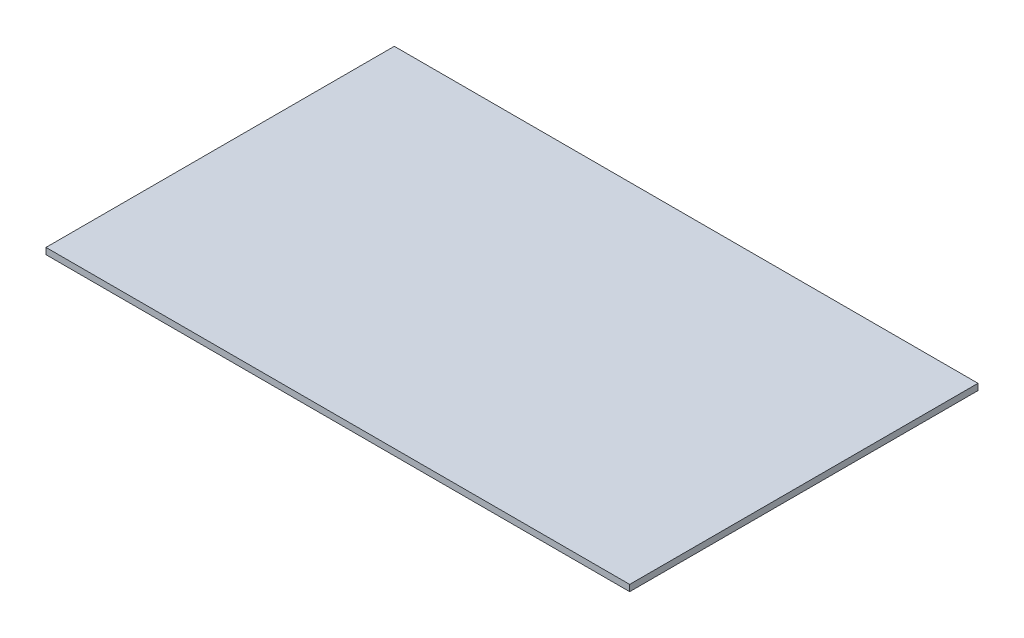
from build123d import *

# Parameters (mm, degrees)
SKETCH_1_W      = 92
SKETCH_1_H      = 54.9
EXTRUDE_1_DEPTH = 1


with BuildPart() as part:
    # Эскиз1 → Бобышка-Вытянуть1 (new body)
    with BuildSketch(Plane(origin=(0, 0, 0), x_dir=(1, 0, 0), z_dir=(0, 1, 0))):
        Rectangle(SKETCH_1_W, SKETCH_1_H)
    extrude(amount=EXTRUDE_1_DEPTH)


solid = part.part
